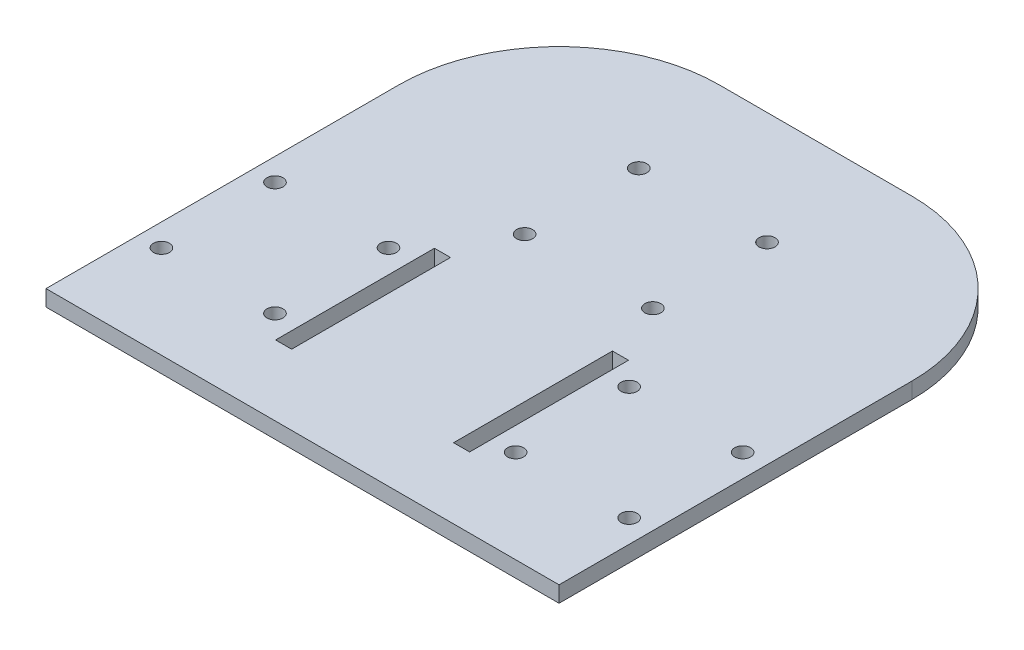
from build123d import *

# Parameters (mm, degrees)
SKETCH1_W           = 203.2
SKETCH1_H           = 203.2
BOSS_EXTRUDE1_DEPTH = 6.35
CUT_EXTRUDE1_DEPTH  = 144.824345992
SKETCH9_R           = 3.175
SKETCH9_W           = 6.35
SKETCH9_H           = 62.924217451
CUT_EXTRUDE2_DEPTH  = 144.824345992


with BuildPart() as part:
    # Sketch1 → Boss-Extrude1 (new body)
    with BuildSketch(Plane(origin=(0, 0, 0), x_dir=(1, 0, 0), z_dir=(0, 1, 0))):
        Rectangle(SKETCH1_W, SKETCH1_H)
    extrude(amount=BOSS_EXTRUDE1_DEPTH)

    # Sketch2 → Cut-Extrude1 (cut, through all)
    with BuildSketch(Plane(origin=(0, 6.35, 0), x_dir=(1, 0, 0), z_dir=(0, 1, 0))):
        with BuildLine():
            Line((101.6, 38.1), (101.6, 101.6))
            Line((101.6, 101.6), (38.1, 101.6))
            ThreePointArc((38.1, 101.6), (83.001280605, 83.001280605), (101.6, 38.1))
        make_face()
        with BuildLine():
            Line((-38.1, 101.6), (-101.6, 101.6))
            Line((-101.6, 101.6), (-101.6, 38.1))
            ThreePointArc((-101.6, 38.1), (-83.001280605, 83.001280605), (-38.1, 101.6))
        make_face()
    extrude(amount=-CUT_EXTRUDE1_DEPTH, mode=Mode.SUBTRACT)

    # Sketch9 → Cut-Extrude2 (cut, through all)
    with BuildSketch(Plane.XZ):
        with Locations((-47.746294791, 64.775705209)):
            Circle(SKETCH9_R)
        with Locations((-47.746294791, 19.812)):
            Circle(SKETCH9_R)
        with Locations((-92.71, 19.812)):
            Circle(SKETCH9_R)
        with Locations((-92.71, 64.775705209)):
            Circle(SKETCH9_R)
        with Locations((-25.490256121, -11.84203867)):
            Circle(SKETCH9_R)
        with Locations((25.309743879, -11.84203867)):
            Circle(SKETCH9_R)
        with Locations((25.309743879, -57.05403867)):
            Circle(SKETCH9_R)
        with Locations((-25.490256121, -57.05403867)):
            Circle(SKETCH9_R)
        with Locations((47.565782549, 19.812)):
            Circle(SKETCH9_R)
        with Locations((92.529487758, 19.812)):
            Circle(SKETCH9_R)
        with Locations((92.529487758, 64.775705209)):
            Circle(SKETCH9_R)
        with Locations((47.565782549, 64.775705209)):
            Circle(SKETCH9_R)
        with Locations((-35.33703867, 42.293852605)):
            Rectangle(SKETCH9_W, SKETCH9_H)
        with Locations((35.156526428, 42.293852605)):
            Rectangle(SKETCH9_W, SKETCH9_H)
    extrude(amount=-CUT_EXTRUDE2_DEPTH, mode=Mode.SUBTRACT)


solid = part.part
